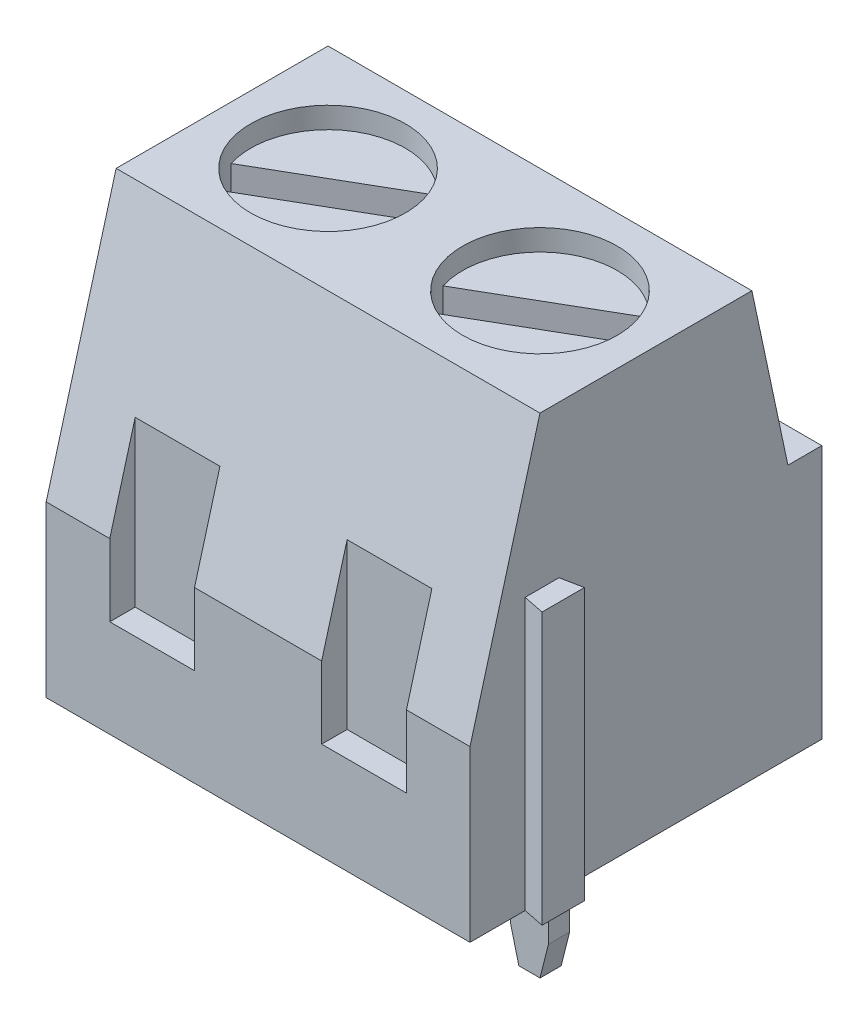
from build123d import *
from build123d.topology import SkipClean

# Parameters (mm, degrees)
BOSS_EXTRUDE1_DEPTH = 2.5
CUT_EXTRUDE1_DEPTH  = 1.25
CHAMFER1_SIZE       = 0.35
CHAMFER1_SIZE_2     = 1.3
CUT_EXTRUDE2_DEPTH  = 1
SKETCH5_R           = 1.825
CUT_EXTRUDE3_DEPTH  = 0.5
CUT_EXTRUDE4_DEPTH  = 0.9
BOSS_EXTRUDE3_DEPTH = 0.45
CHAMFER2_SIZE       = 0.2
CHAMFER2_SIZE2      = 0.79
MIRROR1_START       = -1.36978926
MIRROR1_OUTLINE_W   = 4
MIRROR1_OUTLINE_H   = 0.498489558
MIRROR1_DEPTH       = 0.193883275
LPATTERN1_COUNT     = 2
LPATTERN1_PITCH     = 5
BOSS_EXTRUDE2_DEPTH = 6.4
CUT_EXTRUDE5_DEPTH  = 6.4


# Read off the part's stored shape, not the designer's step: Mirror1
with BuildPart() as part:
    # Sketch2 → Boss-Extrude1 (new, symmetric)
    with BuildSketch(Plane(origin=(0, 0, 0), x_dir=(0, 0, -1), z_dir=(1, 0, 0))):
        Polygon((-4.15, 4), (-4.15, 0), (4.15, 0), (4.15, 6), (3.35, 6), (2.5, 9.99), (-2.5, 9.99), align=None)
    extrude(amount=BOSS_EXTRUDE1_DEPTH, both=True)

    # Sketch3 → Cut-Extrude1 (cut, symmetric)
    with BuildSketch(Plane(origin=(0, 0, 0), x_dir=(0, 0, -1), z_dir=(1, 0, 0))):
        Polygon((4.15, 1), (2.58, 1.84), (-2.25, 1.84), (-2.25, 3.7), (3.2988, 3.7), (3.4175, 4.7), (4.15, 4.7), align=None)
    extrude(amount=CUT_EXTRUDE1_DEPTH, both=True, mode=Mode.SUBTRACT)

    # Chamfer1
    # the kernel refuses this chamfer: 1.3, 0.35 mm, written as the material it takes off along each edge
    with BuildSketch(Plane(origin=(1.25, 4.7, -4.15), x_dir=(0.9905947308102195, 0, -0.1368286493795385), z_dir=(0, -1, 0))) as chamfer1_piece_1_section:
        Polygon((CHAMFER1_SIZE * 0.99059473081, CHAMFER1_SIZE * 0.13682864938), (-CHAMFER1_SIZE_2 * 0.13682864938, CHAMFER1_SIZE_2 * 0.99059473081), (0, 0), align=None)
    chamfer1_piece_1 = extrude(amount=7.075699234, mode=Mode.PRIVATE)
    chamfer1_piece_1 = split(chamfer1_piece_1, bisect_by=Plane(origin=(1.398374335, 1.802145787, -2.650751327), z_dir=(0, 0.8817303170442501, -0.47175380020201896)), keep=Keep.TOP, mode=Mode.PRIVATE)
    chamfer1_piece_1 = split(chamfer1_piece_1, bisect_by=Plane(origin=(1.398374335, 4.303686728, -3.370457615), z_dir=(0, -0.11787251100077023, -0.9930287363165143)), keep=Keep.TOP, mode=Mode.PRIVATE)
    add(chamfer1_piece_1, mode=Mode.SUBTRACT)
    with BuildSketch(Plane(origin=(1.25, 8.075699234, -4.15), x_dir=(0.9905947308102195, 0, -0.1368286493795385), z_dir=(0, -1, 0))) as chamfer1_piece_2_section:
        Polygon((CHAMFER1_SIZE * 0.99059473081, CHAMFER1_SIZE * 0.13682864938), (-CHAMFER1_SIZE_2 * 0.13682864938, CHAMFER1_SIZE_2 * 0.99059473081), (0, 0), align=None)
    chamfer1_piece_2 = extrude(amount=10.451398467, mode=Mode.PRIVATE)
    chamfer1_piece_2 = split(chamfer1_piece_2, bisect_by=Plane(origin=(1.281910217, 1.867643019, -2.528333882), z_dir=(0, 0.8817303170442501, -0.47175380020201896)), keep=Keep.TOP, mode=Mode.PRIVATE)
    chamfer1_piece_2 = split(chamfer1_piece_2, bisect_by=Plane(origin=(1.281910217, 3.7, -3.087047323), z_dir=(0, -1, 0)), keep=Keep.TOP, mode=Mode.PRIVATE)
    add(chamfer1_piece_2, mode=Mode.SUBTRACT)
    with BuildSketch(Plane(origin=(-1.25, 4.7, -4.15), x_dir=(-0.9905947308102195, 0, -0.1368286493795385), z_dir=(0, -1, 0))) as chamfer1_piece_3_section:
        Polygon((CHAMFER1_SIZE * 0.99059473081, -CHAMFER1_SIZE * 0.13682864938), (-CHAMFER1_SIZE_2 * 0.13682864938, -CHAMFER1_SIZE_2 * 0.99059473081), (0, 0), align=None)
    chamfer1_piece_3 = extrude(amount=7.075699234, mode=Mode.PRIVATE)
    chamfer1_piece_3 = split(chamfer1_piece_3, bisect_by=Plane(origin=(-1.398374335, 1.802145787, -2.650751327), z_dir=(0, 0.8817303170442501, -0.47175380020201896)), keep=Keep.TOP, mode=Mode.PRIVATE)
    chamfer1_piece_3 = split(chamfer1_piece_3, bisect_by=Plane(origin=(-1.398374335, 4.303686728, -3.370457615), z_dir=(0, -0.11787251100077023, -0.9930287363165143)), keep=Keep.TOP, mode=Mode.PRIVATE)
    add(chamfer1_piece_3, mode=Mode.SUBTRACT)
    with BuildSketch(Plane(origin=(-1.25, 8.075699234, -4.15), x_dir=(-0.9905947308102195, 0, -0.1368286493795385), z_dir=(0, -1, 0))) as chamfer1_piece_4_section:
        Polygon((CHAMFER1_SIZE * 0.99059473081, -CHAMFER1_SIZE * 0.13682864938), (-CHAMFER1_SIZE_2 * 0.13682864938, -CHAMFER1_SIZE_2 * 0.99059473081), (0, 0), align=None)
    chamfer1_piece_4 = extrude(amount=10.451398467, mode=Mode.PRIVATE)
    chamfer1_piece_4 = split(chamfer1_piece_4, bisect_by=Plane(origin=(-1.281910217, 1.867643019, -2.528333882), z_dir=(0, 0.8817303170442501, -0.47175380020201896)), keep=Keep.TOP, mode=Mode.PRIVATE)
    chamfer1_piece_4 = split(chamfer1_piece_4, bisect_by=Plane(origin=(-1.281910217, 3.7, -3.087047323), z_dir=(0, -1, 0)), keep=Keep.TOP, mode=Mode.PRIVATE)
    add(chamfer1_piece_4, mode=Mode.SUBTRACT)

    # Sketch4 → Cut-Extrude2 (cut, symmetric)
    with BuildSketch(Plane(origin=(0, 0, 0), x_dir=(0, 0, -1), z_dir=(1, 0, 0))):
        Polygon((-4.15, 2.3), (-3.55, 2.3), (-3.55, 6.178181818), (-4.15, 4), align=None)
    extrude(amount=CUT_EXTRUDE2_DEPTH, both=True, mode=Mode.SUBTRACT)

    # Sketch5 → Cut-Extrude3 (cut)
    with BuildSketch(Plane(origin=(0, 9.99, 0), x_dir=(1, 0, 0), z_dir=(0, 1, 0))):
        with Locations(Location((0, 0, 0), (0, 0, 270))):
            Circle(SKETCH5_R)
    extrude(amount=-CUT_EXTRUDE3_DEPTH, mode=Mode.SUBTRACT)

    # Sketch6 → Cut-Extrude4 (cut)
    with SkipClean():  # the faces are left unmerged after this step: merging them gives an invalid solid
        with BuildSketch(Plane(origin=(0, 9.49, 0), x_dir=(1, 0, 0), z_dir=(0, 1, 0))):
            with BuildLine():
                Line((-1.74206639, -0.543902284), (1.34206639, 1.236722607))
                ThreePointArc((1.34206639, 1.236722607), (1.580496362, 0.9125), (1.74206639, 0.543902284))
                Line((1.74206639, 0.543902284), (-1.34206639, -1.236722607))
                ThreePointArc((-1.34206639, -1.236722607), (-1.580496362, -0.9125), (-1.74206639, -0.543902284))
            make_face()
        extrude(amount=-CUT_EXTRUDE4_DEPTH, mode=Mode.SUBTRACT)

    # Sketch9 → Boss-Extrude3 (add, symmetric)
    with SkipClean():  # the faces are left unmerged after this step: merging them gives an invalid solid
        with BuildSketch(Plane(origin=(0, 0, 0), x_dir=(0, 0, -1), z_dir=(1, 0, 0))):
            with BuildLine():
                Line((0.25, -3.803865983), (-0.248489558, -3.803865983))
                Line((-0.248489558, -3.803865983), (-0.248489558, -0.432670696))
                Line((-0.248489558, -0.432670696), (-1.843660044, 0))
                Line((-1.843660044, 0), (0, 0))
                ThreePointArc((0, 0), (0.183674749, -0.206246517), (0.25, -0.474341649))
                Line((0.25, -0.474341649), (0.25, -3.803865983))
            make_face()
        extrude(amount=BOSS_EXTRUDE3_DEPTH, both=True)

    # Chamfer2
    chamfer2_edges = [part.edges().sort_by_distance(p)[0] for p in [
        (0.45, -3.803865983, -0.000755221),
    ]]
    chamfer2_side = [part.faces().sort_by_distance(p)[0] for p in [
        (0, -3.803865983, -0.000755221),
    ]]
    chamfer(chamfer2_edges, length=CHAMFER2_SIZE, length2=CHAMFER2_SIZE2, reference=chamfer2_side[0])

    # Mirror1 outline → Mirror1 (cut)
    with SkipClean():  # the faces are left unmerged after this step: merging them gives an invalid solid
        with BuildSketch(Plane(origin=(0, 0, 0), x_dir=(-0.2454218669703849, 0.9694163745330335, 0), z_dir=(0.9694163745330335, 0.2454218669703849, 0)).offset(MIRROR1_START)):
            with Locations((-3, -0.000755221)):
                Rectangle(MIRROR1_OUTLINE_W, MIRROR1_OUTLINE_H)
        extrude(amount=MIRROR1_DEPTH, mode=Mode.SUBTRACT)


with BuildPart() as lpattern1_1:
    # LPattern1: pattern copy
    add(part.part.moved(Location(Vector(-1, 0, 0) * (1 * LPATTERN1_PITCH))))


with BuildPart() as part_1:
    add(part.part)

    # Combine1: union LPattern1_1
    add(lpattern1_1.part)

    # Sketch8 → Boss-Extrude2 (add)
    with SkipClean():  # the faces are left unmerged after this step: merging them gives an invalid solid
        with BuildSketch(Plane.XZ):
            Polygon((3, 2.45), (2.5, 2.45), (2.5, 2.05), (3, 1.95), align=None)
            Polygon((3, 2.95), (2.5, 2.85), (2.5, 2.45), (3, 2.45), align=None)
        extrude(amount=-BOSS_EXTRUDE2_DEPTH)

    # Sketch8<3> → Cut-Extrude5 (cut)
    with SkipClean():  # the faces are left unmerged after this step: merging them gives an invalid solid
        with BuildSketch(Plane.XZ):
            Polygon((-7, 1.95), (-7, 2.95), (-7.5, 2.85), (-7.5, 2.05), align=None)
        extrude(amount=-CUT_EXTRUDE5_DEPTH, mode=Mode.SUBTRACT)


solid = part_1.part
